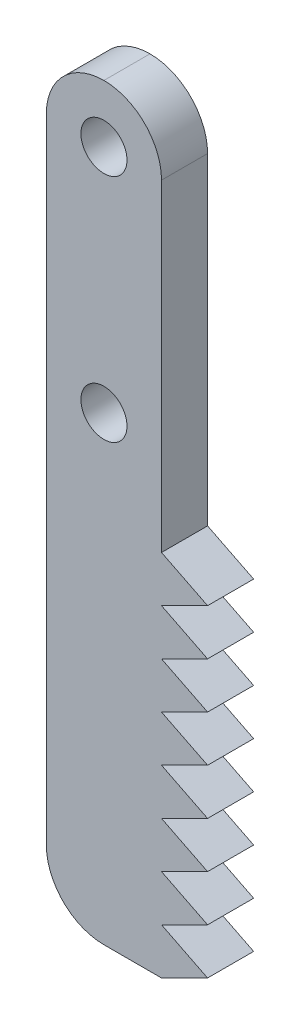
from build123d import *

# Parameters (mm, degrees)
ESQUISSE1_R        = 10
BOSS_EXTRU_1_DEPTH = 20
CONG_1_R           = 25


with BuildPart() as part:
    # Esquisse1 → Boss.-Extru.1 (new body)
    with BuildSketch(Plane.XY):
        Polygon((25, 162.5), (-25, 162.5), (-25, -162.5), (25, -162.5), (45, -152.5), (25, -142.5), (45, -132.5), (25, -122.5), (45, -112.5), (25, -102.5), (45, -92.5), (25, -82.5), (45, -72.5), (25, -62.5), (45, -52.5), (25, -42.5), (45, -32.5), (25, -22.5), (45, -12.5), (25, -2.5), align=None)
        with Locations((0, 37.5)):
            Circle(ESQUISSE1_R, mode=Mode.SUBTRACT)
        with Locations((0, 137.5)):
            Circle(ESQUISSE1_R, mode=Mode.SUBTRACT)
    extrude(amount=BOSS_EXTRU_1_DEPTH)

    # Congé1
    cong_1_edges = [part.edges().sort_by_distance(p)[0] for p in [
        (-25, -162.5, 10),
        (25, 162.5, 10),
        (-25, 162.5, 10),
    ]]
    fillet(cong_1_edges, radius=CONG_1_R - 0.0001)  # a hair under: the kernel refuses the full size


solid = part.part
